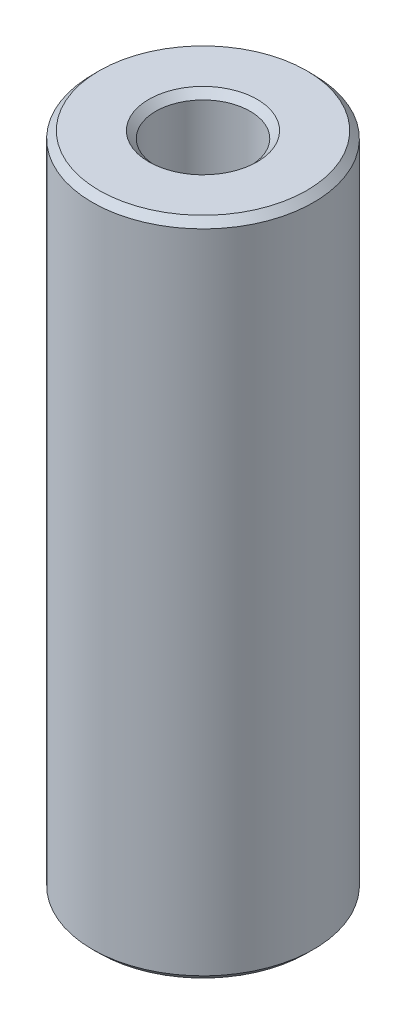
from build123d import *
from OCP.BRepFilletAPI import BRepFilletAPI_MakeChamfer

# Parameters (mm, degrees)
SKETCH1_R           = 52.5
BOSS_EXTRUDE1_DEPTH = 313.638153725
SKETCH2_R           = 22.424558487
CUT_EXTRUDE1_DEPTH  = 323.306362755
CHAMFER1_SIZE       = 3.302324145
CHAMFER1_SIZE2      = 3.248234306


with BuildPart() as part:
    # Sketch1 → Boss-Extrude1 (new body)
    with BuildSketch(Plane(origin=(0, 0, 0), x_dir=(1, 0, 0), z_dir=(0, 1, 0))):
        Circle(SKETCH1_R)
    extrude(amount=BOSS_EXTRUDE1_DEPTH)

    # Sketch2 → Cut-Extrude1 (cut, through all)
    with BuildSketch(Plane(origin=(0, 0, 0), x_dir=(1, 0, 0), z_dir=(0, 1, 0))):
        Circle(SKETCH2_R)
    extrude(amount=CUT_EXTRUDE1_DEPTH, mode=Mode.SUBTRACT)

    # Chamfer1: one chamfer whose edges measure the first distance from different faces: ONE call of the kernel's chamfer builder (chamfer() names one face for all edges)
    chamfer1_edges_1 = [part.edges().sort_by_distance(p)[0] for p in [
        (-22.424558487, 313.638153725, 0),
    ]]
    chamfer1_side_1 = [part.faces().sort_by_distance(p)[0] for p in [
        (-51.01507576, 313.638153725, 0),
    ]]
    chamfer1_edges_2 = [part.edges().sort_by_distance(p)[0] for p in [
        (-22.424558487, 0, 0),
    ]]
    chamfer1_side_2 = [part.faces().sort_by_distance(p)[0] for p in [
        (-22.424558487, 156.819076863, 0),
    ]]
    chamfer1_edges_3 = [part.edges().sort_by_distance(p)[0] for p in [
        (-52.5, 0, 0),
    ]]
    chamfer1_side_3 = [part.faces().sort_by_distance(p)[0] for p in [
        (-51.01507576, 0, 0),
    ]]
    chamfer1_edges_4 = [part.edges().sort_by_distance(p)[0] for p in [
        (-52.5, 313.638153725, 0),
    ]]
    chamfer1_side_4 = [part.faces().sort_by_distance(p)[0] for p in [
        (-52.5, 156.819076863, 0),
    ]]
    chamfer1 = BRepFilletAPI_MakeChamfer(part.part.solid().wrapped)
    for e in chamfer1_edges_1:
        chamfer1.Add(CHAMFER1_SIZE, CHAMFER1_SIZE2, e.wrapped, chamfer1_side_1[0].wrapped)  # the first distance lies on this face
    for e in chamfer1_edges_2:
        chamfer1.Add(CHAMFER1_SIZE, CHAMFER1_SIZE2, e.wrapped, chamfer1_side_2[0].wrapped)  # the first distance lies on this face
    for e in chamfer1_edges_3:
        chamfer1.Add(CHAMFER1_SIZE, CHAMFER1_SIZE2, e.wrapped, chamfer1_side_3[0].wrapped)  # the first distance lies on this face
    for e in chamfer1_edges_4:
        chamfer1.Add(CHAMFER1_SIZE, CHAMFER1_SIZE2, e.wrapped, chamfer1_side_4[0].wrapped)  # the first distance lies on this face
    add(Compound.cast(chamfer1.Shape()), mode=Mode.REPLACE)


solid = part.part
